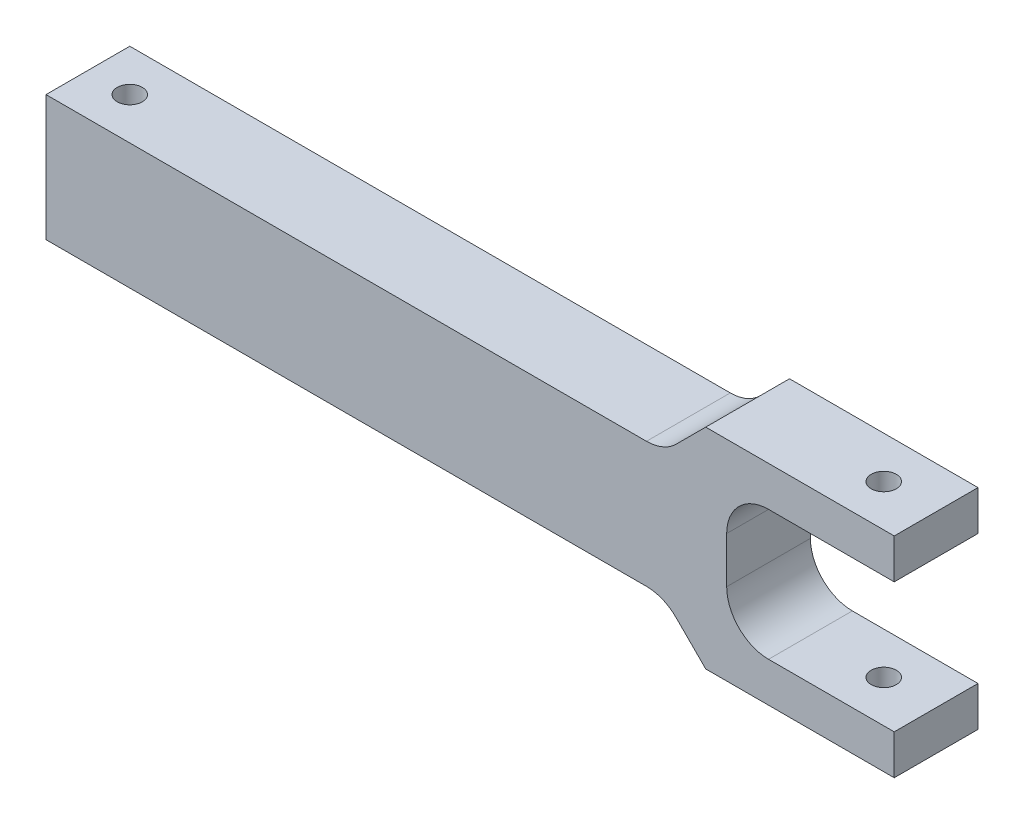
from build123d import *

# Parameters (mm, degrees)
SKETCH1_W           = 202.5
SKETCH1_H           = 20
SKETCH1_R           = 3
BOSS_EXTRUDE1_DEPTH = 50
SKETCH2_W           = 80
SKETCH2_H           = 31
SKETCH2_W_2         = 147.5
SKETCH2_H_2         = 10
CUT_EXTRUDE1_DEPTH  = 25
CHAMFER1_SIZE       = 10
FILLET1_R           = 10
FILLET2_START       = -10
FILLET2_DEPTH       = 20


with BuildPart() as part:
    # Sketch1 → Boss-Extrude1 (new body)
    with BuildSketch(Plane(origin=(0, 0, 0), x_dir=(1, 0, 0), z_dir=(0, 1, 0))):
        Rectangle(SKETCH1_W, SKETCH1_H)
        with Locations(Location((-91.25, 0, 0), (0, 0, 270))):
            Circle(SKETCH1_R, mode=Mode.SUBTRACT)
        with Locations(Location((88.75, 0, 0), (0, 0, 270))):
            Circle(SKETCH1_R, mode=Mode.SUBTRACT)
    extrude(amount=BOSS_EXTRUDE1_DEPTH)

    # Sketch2 → Cut-Extrude1 (cut)
    with BuildSketch(Plane.XY.offset(10)):
        with Locations((101.25, 25)):
            Rectangle(SKETCH2_W, SKETCH2_H)
        with Locations((-27.5, 45)):
            Rectangle(SKETCH2_W_2, SKETCH2_H_2)
        with Locations((-27.5, 5)):
            Rectangle(SKETCH2_W_2, SKETCH2_H_2)
    extrude(amount=-CUT_EXTRUDE1_DEPTH, mode=Mode.SUBTRACT)

    # Chamfer1
    chamfer1_edges = [part.edges().sort_by_distance(p)[0] for p in [
        (46.25, 0, 0),
        (46.25, 50, 0),
    ]]
    chamfer(chamfer1_edges, length=CHAMFER1_SIZE - 0.0001)  # a hair under: the kernel refuses the full size

    # Fillet1
    fillet1_edges = [part.edges().sort_by_distance(p)[0] for p in [
        (61.25, 9.5, 0),
        (61.25, 40.5, 0),
    ]]
    fillet(fillet1_edges, radius=FILLET1_R)

    # Fillet2: read off the stored shape, not the designer's step
    # Fillet2 outline → Fillet2 (add)
    with BuildSketch(Plane.XY.offset(FILLET2_START)):
        with BuildLine():
            ThreePointArc((49.178932188, 42.928932188), (45.9346987, 40.761204675), (42.107864376, 40))
            Line((42.107864376, 40), (46.25, 40))
            Line((46.25, 40), (49.178932188, 42.928932188))
        make_face()
        with BuildLine():
            Line((46.25, 10), (42.107864376, 10))
            ThreePointArc((42.107864376, 10), (45.9346987, 9.238795325), (49.178932188, 7.071067812))
            Line((49.178932188, 7.071067812), (46.25, 10))
        make_face()
    extrude(amount=FILLET2_DEPTH)


solid = part.part
